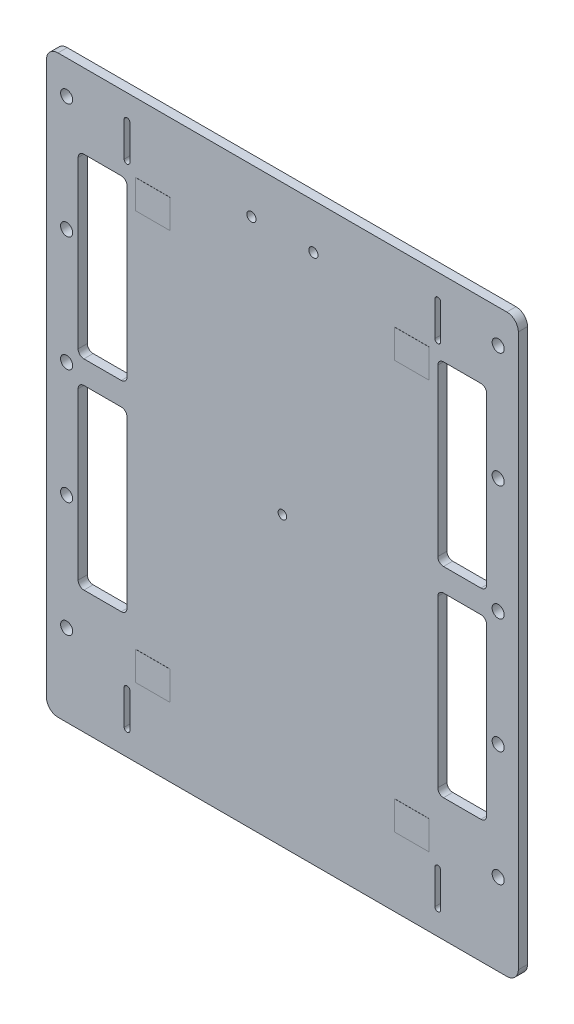
from build123d import *

# Parameters (mm, degrees)
BOSS_EXTRUDE1_DEPTH  = 1.6
SKETCH2_R            = 0.75
SKETCH2_R_2          = 1.05
SKETCH2_R_3          = 0.8
CUT_EXTRUDE1_DEPTH   = 65.680445267
CUT_EXTRUDE2_DEPTH   = 65.680445267
CUT_EXTRUDE3_DEPTH   = 1.6
SKETCH5_W            = 6
SKETCH5_H            = 5
BOSS_EXTRUDE2_DEPTH  = 0.02
M2_CLEARANCE_HOLE1_D = 2.1


with BuildPart() as part:
    # Sketch1 → Boss-Extrude1 (new body)
    with BuildSketch(Plane.XY):
        with BuildLine():
            Line((-39, -50), (39, -50))
            ThreePointArc((39, -50), (40.414213562, -49.414213562), (41, -48))
            Line((41, -48), (41, 48))
            ThreePointArc((41, 48), (40.414213562, 49.414213562), (39, 50))
            Line((39, 50), (-39, 50))
            ThreePointArc((-39, 50), (-40.414213562, 49.414213562), (-41, 48))
            Line((-41, 48), (-41, -48))
            ThreePointArc((-41, -48), (-40.414213562, -49.414213562), (-39, -50))
        make_face()
    extrude(amount=BOSS_EXTRUDE1_DEPTH)

    # Sketch2 → Cut-Extrude1 (cut, through all)
    with BuildSketch(Plane.XY.offset(1.6)):
        Circle(SKETCH2_R)
        with Locations((-37.5, 44.2)):
            Circle(SKETCH2_R_2)
        with Locations((37.5, 44.2)):
            Circle(SKETCH2_R_2)
        with Locations((37.5, 4.2)):
            Circle(SKETCH2_R_2)
        with Locations((37.5, -35.8)):
            Circle(SKETCH2_R_2)
        with Locations((-37.5, 4.2)):
            Circle(SKETCH2_R_2)
        with Locations((-37.5, -35.8)):
            Circle(SKETCH2_R_2)
        with Locations((-5.38, 42.15)):
            Circle(SKETCH2_R_3)
        with Locations((5.39, 42.15)):
            Circle(SKETCH2_R_3)
    extrude(amount=-CUT_EXTRUDE1_DEPTH, mode=Mode.SUBTRACT)

    # Sketch3 → Cut-Extrude2 (cut, through all)
    with BuildSketch(Plane.XY.offset(1.6)):
        with BuildLine():
            Line((-34.5, 37), (-28, 37))
            ThreePointArc((-28, 37), (-27.292893219, 36.707106781), (-27, 36))
            Line((-27, 36), (-27, 7.2))
            ThreePointArc((-27, 7.2), (-27.292893219, 6.492893219), (-28, 6.2))
            Line((-28, 6.2), (-34.5, 6.2))
            ThreePointArc((-34.5, 6.2), (-35.207106781, 6.492893219), (-35.5, 7.2))
            Line((-35.5, 7.2), (-35.5, 36))
            ThreePointArc((-35.5, 36), (-35.207106781, 36.707106781), (-34.5, 37))
        make_face()
        with BuildLine():
            Line((28, 37), (34.5, 37))
            ThreePointArc((34.5, 37), (35.207106781, 36.707106781), (35.5, 36))
            Line((35.5, 36), (35.5, 7.2))
            ThreePointArc((35.5, 7.2), (35.207106781, 6.492893219), (34.5, 6.2))
            Line((34.5, 6.2), (28, 6.2))
            ThreePointArc((28, 6.2), (27.292893219, 6.492893219), (27, 7.2))
            Line((27, 7.2), (27, 36))
            ThreePointArc((27, 36), (27.292893219, 36.707106781), (28, 37))
        make_face()
        with BuildLine():
            Line((28, 2.2), (34.5, 2.2))
            ThreePointArc((34.5, 2.2), (35.207106781, 1.907106781), (35.5, 1.2))
            Line((35.5, 1.2), (35.5, -27.6))
            ThreePointArc((35.5, -27.6), (35.207106781, -28.307106781), (34.5, -28.6))
            Line((34.5, -28.6), (28, -28.6))
            ThreePointArc((28, -28.6), (27.292893219, -28.307106781), (27, -27.6))
            Line((27, -27.6), (27, 1.2))
            ThreePointArc((27, 1.2), (27.292893219, 1.907106781), (28, 2.2))
        make_face()
        with BuildLine():
            Line((-34.5, 2.2), (-28, 2.2))
            ThreePointArc((-28, 2.2), (-27.292893219, 1.907106781), (-27, 1.2))
            Line((-27, 1.2), (-27, -27.6))
            ThreePointArc((-27, -27.6), (-27.292893219, -28.307106781), (-28, -28.6))
            Line((-28, -28.6), (-34.5, -28.6))
            ThreePointArc((-34.5, -28.6), (-35.207106781, -28.307106781), (-35.5, -27.6))
            Line((-35.5, -27.6), (-35.5, 1.2))
            ThreePointArc((-35.5, 1.2), (-35.207106781, 1.907106781), (-34.5, 2.2))
        make_face()
    extrude(amount=-CUT_EXTRUDE2_DEPTH, mode=Mode.SUBTRACT)

    # Sketch4 → Cut-Extrude3 (cut)
    with BuildSketch(Plane.XY.offset(1.6)):
        with BuildLine():
            Line((-27.5, 39.75), (-27.5, 45.75))
            ThreePointArc((-27.5, 45.75), (-27, 46.25), (-26.5, 45.75))
            Line((-26.5, 45.75), (-26.5, 39.75))
            ThreePointArc((-26.5, 39.75), (-27, 39.25), (-27.5, 39.75))
        make_face()
        with BuildLine():
            Line((26.5, 39.75), (26.5, 45.75))
            ThreePointArc((26.5, 45.75), (27, 46.25), (27.5, 45.75))
            Line((27.5, 45.75), (27.5, 39.75))
            ThreePointArc((27.5, 39.75), (27, 39.25), (26.5, 39.75))
        make_face()
        with BuildLine():
            Line((26.5, -45.75), (26.5, -39.75))
            ThreePointArc((26.5, -39.75), (27, -39.25), (27.5, -39.75))
            Line((27.5, -39.75), (27.5, -45.75))
            ThreePointArc((27.5, -45.75), (27, -46.25), (26.5, -45.75))
        make_face()
        with BuildLine():
            Line((-27.5, -45.75), (-27.5, -39.75))
            ThreePointArc((-27.5, -39.75), (-27, -39.25), (-26.5, -39.75))
            Line((-26.5, -39.75), (-26.5, -45.75))
            ThreePointArc((-26.5, -45.75), (-27, -46.25), (-27.5, -45.75))
        make_face()
    extrude(amount=-CUT_EXTRUDE3_DEPTH, mode=Mode.SUBTRACT)

    # Sketch5 → Boss-Extrude2 (add)
    with BuildSketch(Plane.XY.offset(1.6)):
        with Locations((-22.5, 35.5)):
            Rectangle(SKETCH5_W, SKETCH5_H)
        with Locations((22.5, 35.5)):
            Rectangle(SKETCH5_W, SKETCH5_H)
        with Locations((22.5, -35.5)):
            Rectangle(SKETCH5_W, SKETCH5_H)
        with Locations((-22.5, -35.5)):
            Rectangle(SKETCH5_W, SKETCH5_H)
    extrude(amount=BOSS_EXTRUDE2_DEPTH)

    # M2 Clearance Hole1 (through all)
    with Locations(Plane(origin=(0, 0, 0), x_dir=(-1, 0, 0), z_dir=(0, 0, -1))):
        with Locations((-37.5, 24.2), (-37.5, -15.8), (37.5, -15.8), (37.5, 24.2)):
            Hole(M2_CLEARANCE_HOLE1_D / 2)


solid = part.part
